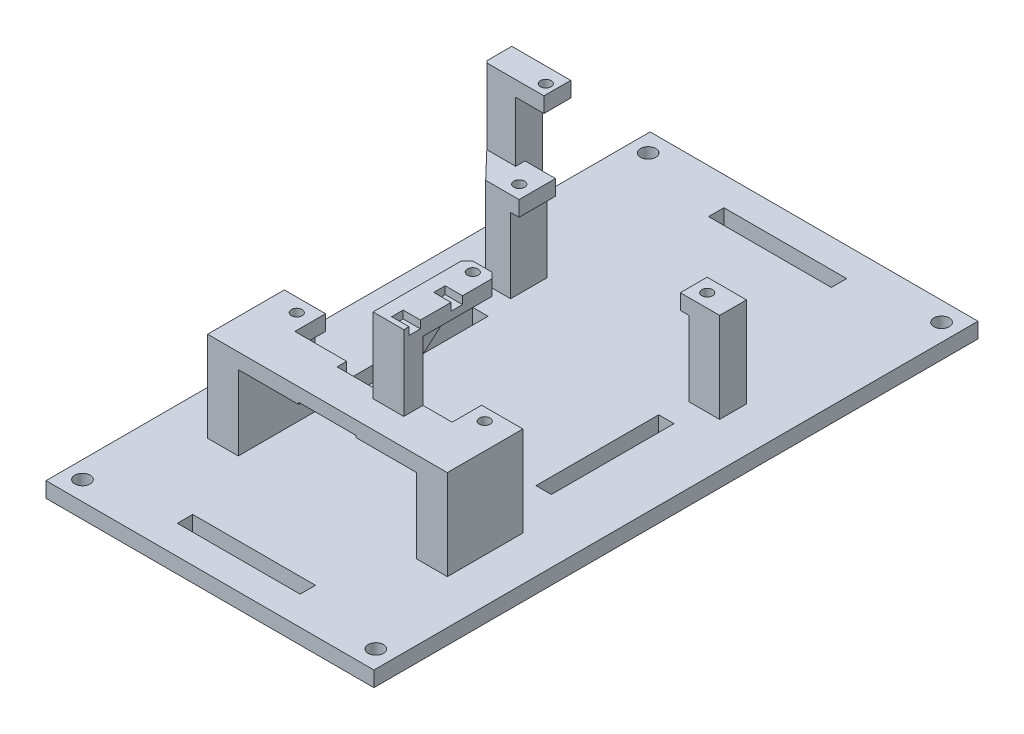
from build123d import *

# Parameters (mm, degrees)
SKETCH1_W                 = 85.5
SKETCH1_H                 = 157.5
BOSS_EXTRUDE1_DEPTH       = 4
CUT_EXTRUDE1_REACH        = 91.695
SKETCH2_R                 = 2
CUT_EXTRUDE3_REACH        = 91.695
SKETCH5_W                 = 4
SKETCH5_H                 = 32
SKETCH5_W_2               = 32
SKETCH5_H_2               = 4
SKETCH5_3_W               = 8
SKETCH5_3_H               = 7
SKETCH5_3_H_2             = 20
SKETCH5_3_H_3             = 19.7
BOSS_EXTRUDE3_DEPTH       = 23.5
SKETCH6_W                 = 20
SKETCH6_H                 = 4
BOSS_EXTRUDE5_DEPTH       = 46.5
CUT_EXTRUDE4_REACH        = 95.73
SKETCH8_W                 = 7
SKETCH8_H                 = 4
BOSS_EXTRUDE6_DEPTH       = 2.25
SKETCH9_W                 = 9.5
SKETCH9_H                 = 4
BOSS_EXTRUDE7_DEPTH       = 2.2
CUT_EXTRUDE5_START        = 23.5
SKETCH5_5_R               = 1.4
CUT_EXTRUDE5_DEPTH        = 3.5
SKETCH13_W                = 8
SKETCH13_H                = 7
SKETCH13_H_2              = 5
BOSS_EXTRUDE8_DEPTH       = 19.6
CUT_EXTRUDE11_REACH       = 95.73
SKETCH14_W                = 7
SKETCH14_H                = 4
BOSS_EXTRUDE9_DEPTH       = 7.37
SKETCH15_W                = 8
SKETCH15_H                = 4
BOSS_EXTRUDE10_DEPTH      = 19.49132
CUT_EXTRUDE6_START        = 39.1
SKETCH5_6_R               = 1.4
CUT_EXTRUDE6_DEPTH        = 4
SKETCH16_W                = 4.5
SKETCH16_H                = 3
CUT_EXTRUDE7_DEPTH        = 2
CHAMFER1_SIZE             = 1.5
BOSS_EXTRUDE11_DEPTH      = 2
BOSS_EXTRUDE11_DEPTH_BACK = 2
CUT_EXTRUDE8_REACH        = 134.032
SKETCH20_W                = 5.75
SKETCH20_H                = 6
CHAMFER2_SIZE             = 5.75
SKETCH21_W                = 2.25
SKETCH21_H                = 6
CUT_EXTRUDE9_DEPTH        = 4.56132
CHAMFER3_SIZE             = 5.75
CHAMFER3_SIZE2            = 4.56132
SKETCH22_W                = 14
SKETCH22_H                = 2.5
CUT_EXTRUDE10_DEPTH       = 2.5
CHAMFER4_SIZE             = 2.5
SKETCH24_W                = 15
SKETCH24_H                = 12
CUT_EXTRUDE12_DEPTH       = 0.5


# Some blends are built 0.0001 mm under size
with BuildPart() as part:
    # Sketch1 → Boss-Extrude1 (new body)
    with BuildSketch(Plane(origin=(0, 0, 0), x_dir=(1, 0, 0), z_dir=(0, 1, 0))):
        Rectangle(SKETCH1_W, SKETCH1_H)
    extrude(amount=BOSS_EXTRUDE1_DEPTH)

    # Sketch2 → Cut-Extrude1 (cut, up to next)
    with BuildSketch(Plane(origin=(0, 4, 0), x_dir=(1, 0, 0), z_dir=(0, 1, 0)), mode=Mode.PRIVATE) as cut_extrude1_sk1:
        with Locations(Location((38.25, -73.75, 0), (0, 0, 270))):
            Circle(SKETCH2_R)
    cut_extrude1_tool1 = extrude(cut_extrude1_sk1.sketch, amount=-CUT_EXTRUDE1_REACH, mode=Mode.PRIVATE) & part.part
    # Sketch2 → Cut-Extrude1 (cut, up to next)
    with BuildSketch(Plane(origin=(0, 4, 0), x_dir=(1, 0, 0), z_dir=(0, 1, 0)), mode=Mode.PRIVATE) as cut_extrude1_sk2:
        with Locations(Location((38.25, 73.75, 0), (0, 0, 270))):
            Circle(SKETCH2_R)
    cut_extrude1_tool2 = extrude(cut_extrude1_sk2.sketch, amount=-CUT_EXTRUDE1_REACH, mode=Mode.PRIVATE) & part.part
    # Sketch2 → Cut-Extrude1 (cut, up to next)
    with BuildSketch(Plane(origin=(0, 4, 0), x_dir=(1, 0, 0), z_dir=(0, 1, 0)), mode=Mode.PRIVATE) as cut_extrude1_sk3:
        with Locations(Location((-38.25, -73.75, 0), (0, 0, 270))):
            Circle(SKETCH2_R)
    cut_extrude1_tool3 = extrude(cut_extrude1_sk3.sketch, amount=-CUT_EXTRUDE1_REACH, mode=Mode.PRIVATE) & part.part
    # Sketch2 → Cut-Extrude1 (cut, up to next)
    with BuildSketch(Plane(origin=(0, 4, 0), x_dir=(1, 0, 0), z_dir=(0, 1, 0)), mode=Mode.PRIVATE) as cut_extrude1_sk4:
        with Locations(Location((-38.25, 73.75, 0), (0, 0, 270))):
            Circle(SKETCH2_R)
    cut_extrude1_tool4 = extrude(cut_extrude1_sk4.sketch, amount=-CUT_EXTRUDE1_REACH, mode=Mode.PRIVATE) & part.part
    add(cut_extrude1_tool1.solids().sort_by_distance((38.25, 4, 73.75))[0], mode=Mode.SUBTRACT)
    add(cut_extrude1_tool2.solids().sort_by_distance((38.25, 4, -73.75))[0], mode=Mode.SUBTRACT)
    add(cut_extrude1_tool3.solids().sort_by_distance((-38.25, 4, 73.75))[0], mode=Mode.SUBTRACT)
    add(cut_extrude1_tool4.solids().sort_by_distance((-38.25, 4, -73.75))[0], mode=Mode.SUBTRACT)

    # Sketch5 → Cut-Extrude3 (cut, up to next)
    with BuildSketch(Plane(origin=(0, 4, 0), x_dir=(1, 0, 0), z_dir=(0, 1, 0)), mode=Mode.PRIVATE) as cut_extrude3_sk1:
        with Locations((-24.25, 0)):
            Rectangle(SKETCH5_W, SKETCH5_H)
    cut_extrude3_tool1 = extrude(cut_extrude3_sk1.sketch, amount=-CUT_EXTRUDE3_REACH, mode=Mode.PRIVATE) & part.part
    # Sketch5 → Cut-Extrude3 (cut, up to next)
    with BuildSketch(Plane(origin=(0, 4, 0), x_dir=(1, 0, 0), z_dir=(0, 1, 0)), mode=Mode.PRIVATE) as cut_extrude3_sk2:
        with Locations((0, 69.25)):
            Rectangle(SKETCH5_W_2, SKETCH5_H_2)
    cut_extrude3_tool2 = extrude(cut_extrude3_sk2.sketch, amount=-CUT_EXTRUDE3_REACH, mode=Mode.PRIVATE) & part.part
    # Sketch5 → Cut-Extrude3 (cut, up to next)
    with BuildSketch(Plane(origin=(0, 4, 0), x_dir=(1, 0, 0), z_dir=(0, 1, 0)), mode=Mode.PRIVATE) as cut_extrude3_sk3:
        with Locations((0, -69.25)):
            Rectangle(SKETCH5_W_2, SKETCH5_H_2)
    cut_extrude3_tool3 = extrude(cut_extrude3_sk3.sketch, amount=-CUT_EXTRUDE3_REACH, mode=Mode.PRIVATE) & part.part
    # Sketch5 → Cut-Extrude3 (cut, up to next)
    with BuildSketch(Plane(origin=(0, 4, 0), x_dir=(1, 0, 0), z_dir=(0, 1, 0)), mode=Mode.PRIVATE) as cut_extrude3_sk4:
        with Locations((24.25, 0)):
            Rectangle(SKETCH5_W, SKETCH5_H)
    cut_extrude3_tool4 = extrude(cut_extrude3_sk4.sketch, amount=-CUT_EXTRUDE3_REACH, mode=Mode.PRIVATE) & part.part
    add(cut_extrude3_tool1.solids().sort_by_distance((-24.25, 4, 0))[0], mode=Mode.SUBTRACT)
    add(cut_extrude3_tool2.solids().sort_by_distance((0, 4, -69.25))[0], mode=Mode.SUBTRACT)
    add(cut_extrude3_tool3.solids().sort_by_distance((0, 4, 69.25))[0], mode=Mode.SUBTRACT)
    add(cut_extrude3_tool4.solids().sort_by_distance((24.25, 4, 0))[0], mode=Mode.SUBTRACT)

    # Sketch5<3> → Boss-Extrude3 (add)
    with BuildSketch(Plane(origin=(0, 4, 0), x_dir=(1, 0, 0), z_dir=(0, 1, 0))):
        Polygon((-37, 36.94993), (-29, 36.94993), (-29, 32.38861), (-23.25, 32.38861), (-23.25, 22.88861), (-29.75, 22.88861), (-37, 30.44993), align=None)
        with Locations((27.25, 26.38861)):
            Rectangle(SKETCH5_3_W, SKETCH5_3_H)
        with Locations((-27.25, -38.11139)):
            Rectangle(SKETCH5_3_W, SKETCH5_3_H_2)
        with Locations((27.25, -38.26139)):
            Rectangle(SKETCH5_3_W, SKETCH5_3_H_3)
    extrude(amount=BOSS_EXTRUDE3_DEPTH)

    # Sketch6 → Boss-Extrude5 (add)
    with BuildSketch(Plane(origin=(-23.25, 0, 0), x_dir=(0, 0, -1), z_dir=(1, 0, 0))):
        with Locations((-38.11139, 25.5)):
            Rectangle(SKETCH6_W, SKETCH6_H)
    extrude(amount=BOSS_EXTRUDE5_DEPTH)

    # Sketch7 → Cut-Extrude4 (cut, up to next)
    with BuildSketch(Plane(origin=(0, 27.5, 0), x_dir=(1, 0, 0), z_dir=(0, 1, 0)), mode=Mode.PRIVATE) as cut_extrude4_sk1:
        Polygon((-20.5, -28.11139), (23.25, -28.11139), (23.25, -28.41139), (20.5, -28.41139), (20.5, -36.11139), (-20.5, -36.11139), align=None)
    cut_extrude4_tool1 = extrude(cut_extrude4_sk1.sketch, amount=-CUT_EXTRUDE4_REACH, mode=Mode.PRIVATE) & part.part
    add(cut_extrude4_tool1.solids().sort_by_distance((0.054883, 27.5, 32.101731))[0], mode=Mode.SUBTRACT)

    # Sketch8 → Boss-Extrude6 (add)
    with BuildSketch(Plane.ZY.offset(-23.25)):
        with Locations((-26.38861, 25.5)):
            Rectangle(SKETCH8_W, SKETCH8_H)
    extrude(amount=BOSS_EXTRUDE6_DEPTH)

    # Sketch9 → Boss-Extrude7 (add)
    with BuildSketch(Plane(origin=(-23.25, 0, 0), x_dir=(0, 0, -1), z_dir=(1, 0, 0))):
        with Locations((27.63861, 25.5)):
            Rectangle(SKETCH9_W, SKETCH9_H)
    extrude(amount=BOSS_EXTRUDE7_DEPTH)

    # Sketch5<5> → Cut-Extrude5 (cut)
    with BuildSketch(Plane(origin=(0, 4, 0), x_dir=(1, 0, 0), z_dir=(0, 1, 0)).offset(CUT_EXTRUDE5_START)):
        with Locations(Location((-24.5, 26.38861, 0), (0, 0, 270))):
            Circle(SKETCH5_5_R)
        with Locations(Location((24.5, -31.61139, 0), (0, 0, 270))):
            Circle(SKETCH5_5_R)
        with Locations(Location((24.5, 26.38861, 0), (0, 0, 270))):
            Circle(SKETCH5_5_R)
        with Locations(Location((-24.5, -31.61139, 0), (0, 0, 270))):
            Circle(SKETCH5_5_R)
    extrude(amount=-CUT_EXTRUDE5_DEPTH, mode=Mode.SUBTRACT)

    # Sketch13 → Boss-Extrude8 (add)
    with BuildSketch(Plane(origin=(0, 27.5, 0), x_dir=(1, 0, 0), z_dir=(0, 1, 0))):
        with Locations((-33, 33.44993)):
            Rectangle(SKETCH13_W, SKETCH13_H)
        with Locations((8.89, -38.61139)):
            Rectangle(SKETCH13_W, SKETCH13_H_2)
    extrude(amount=BOSS_EXTRUDE8_DEPTH)

    # Sketch23 → Cut-Extrude11 (cut, up to next)
    with BuildSketch(Plane.XZ.offset(-27.5), mode=Mode.PRIVATE) as cut_extrude11_sk1:
        Polygon((-37, -29.94993), (-37, -30.44993), (-36.520586353, -29.94993), align=None)
    cut_extrude11_tool1 = extrude(cut_extrude11_sk1.sketch, amount=-CUT_EXTRUDE11_REACH, mode=Mode.PRIVATE) & part.part
    add(cut_extrude11_tool1.solids().sort_by_distance((-36.840195, 27.5, -30.116597))[0], mode=Mode.SUBTRACT)

    # Sketch14 → Boss-Extrude9 (add)
    with BuildSketch(Plane(origin=(-29, 0, 0), x_dir=(0, 0, -1), z_dir=(1, 0, 0))):
        with Locations((33.44993, 45.1)):
            Rectangle(SKETCH14_W, SKETCH14_H)
    extrude(amount=BOSS_EXTRUDE9_DEPTH)

    # Sketch15 → Boss-Extrude10 (add)
    with BuildSketch(Plane(origin=(0, 0, 36.11139), x_dir=(-1, 0, 0), z_dir=(0, 0, -1))):
        with Locations((-8.89, 45.1)):
            Rectangle(SKETCH15_W, SKETCH15_H)
    extrude(amount=BOSS_EXTRUDE10_DEPTH)

    # Sketch5<6> → Cut-Extrude6 (cut)
    with BuildSketch(Plane(origin=(0, 4, 0), x_dir=(1, 0, 0), z_dir=(0, 1, 0)).offset(CUT_EXTRUDE6_START)):
        with Locations(Location((-24.13, 32.94993, 0), (0, 0, 270))):
            Circle(SKETCH5_6_R)
        with Locations(Location((8.89, -19.12007, 0), (0, 0, 270))):
            Circle(SKETCH5_6_R)
    extrude(amount=CUT_EXTRUDE6_DEPTH, mode=Mode.SUBTRACT)

    # Sketch16 → Cut-Extrude7 (cut)
    with BuildSketch(Plane(origin=(0, 47.1, 0), x_dir=(1, 0, 0), z_dir=(0, 1, 0))):
        with Locations((10.64, -27.29907)):
            Rectangle(SKETCH16_W, SKETCH16_H)
        with Locations((10.64, -38.27207)):
            Rectangle(SKETCH16_W, SKETCH16_H)
    extrude(amount=-CUT_EXTRUDE7_DEPTH, mode=Mode.SUBTRACT)

    # Chamfer1
    chamfer1_edges = [part.edges().sort_by_distance(p)[0] for p in [
        (12.89, 45.1, 16.62007),
        (4.89, 45.1, 16.62007),
    ]]
    chamfer(chamfer1_edges, length=CHAMFER1_SIZE)

    # Sketch19 → Boss-Extrude11 (add, two sides: drawn at the far end of the back side and taken through both)
    with BuildSketch(Plane.ZY.offset(-8.89).offset(-BOSS_EXTRUDE11_DEPTH_BACK)):
        Polygon((27.11573, 43.1), (36.11139, 35.3), (36.11139, 43.1), align=None)
    extrude(amount=BOSS_EXTRUDE11_DEPTH + BOSS_EXTRUDE11_DEPTH_BACK)

    # Cut-Extrude8: up to this plane
    cut_extrude8_end = Plane(origin=(-4.065843585, 27.5, 3.898441805), z_dir=(0.7218100693808475, 0, -0.6920911961153792))
    # Sketch20 → Cut-Extrude8 (cut, up to the surface)
    with BuildSketch(Plane(origin=(0, 0, -36.94993), x_dir=(-1, 0, 0), z_dir=(0, 0, -1)), mode=Mode.PRIVATE) as cut_extrude8_sk1:
        with Locations((34.125, 7)):
            Rectangle(SKETCH20_W, SKETCH20_H)
    cut_extrude8_tool1 = split(extrude(cut_extrude8_sk1.sketch, amount=-CUT_EXTRUDE8_REACH, mode=Mode.PRIVATE), bisect_by=cut_extrude8_end, keep=Keep.BOTH, mode=Mode.PRIVATE)
    add(cut_extrude8_tool1.solids().sort_by_distance((-34.125, 7, -36.94993))[0], mode=Mode.SUBTRACT)

    # Chamfer2
    chamfer2_edges = [part.edges().sort_by_distance(p)[0] for p in [
        (-37, 10, -33.69993),
    ]]
    chamfer(chamfer2_edges, length=CHAMFER2_SIZE - 0.0001)  # a hair under: the kernel refuses the full size

    # Sketch21 → Cut-Extrude9 (cut)
    with BuildSketch(Plane(origin=(0, 0, -36.94993), x_dir=(-1, 0, 0), z_dir=(0, 0, -1))):
        with Locations((30.125, 7)):
            Rectangle(SKETCH21_W, SKETCH21_H)
    extrude(amount=-CUT_EXTRUDE9_DEPTH, mode=Mode.SUBTRACT)

    # Chamfer3
    chamfer3_edges = [part.edges().sort_by_distance(p)[0] for p in [
        (-30.125, 10, -36.94993),
    ]]
    chamfer3_side = [part.faces().sort_by_distance(p)[0] for p in [
        (-32.15740492, 31.012813369, -36.94993),
    ]]
    chamfer(chamfer3_edges, length=CHAMFER3_SIZE, length2=CHAMFER3_SIZE2, reference=chamfer3_side[0])

    # Sketch22 → Cut-Extrude10 (cut)
    with BuildSketch(Plane(origin=(0, 27.5, 0), x_dir=(1, 0, 0), z_dir=(0, 1, 0))):
        with Locations((0, -37.36139)):
            Rectangle(SKETCH22_W, SKETCH22_H)
    extrude(amount=-CUT_EXTRUDE10_DEPTH, mode=Mode.SUBTRACT)

    # Chamfer4
    # the kernel refuses this chamfer: 2.5 mm, written as the material it takes off along each edge
    with BuildSketch(Plane(origin=(4.89, 27.5, 45.04059747), x_dir=(0, 1, 0), z_dir=(0, 0, -1))) as chamfer4_piece_1_section:
        Polygon((CHAMFER4_SIZE, 0), (0, CHAMFER4_SIZE), (0, 0), align=None)
    chamfer4_piece_1 = extrude(amount=15.35841494, mode=Mode.PRIVATE)
    chamfer4_piece_1 = split(chamfer4_piece_1, bisect_by=Plane(origin=(7, 27.5, 45.04059747), z_dir=(-1, 0, 0)), keep=Keep.TOP, mode=Mode.PRIVATE)
    chamfer4_piece_1 = split(chamfer4_piece_1, bisect_by=Plane(origin=(4.89, 24.285396265, 41.825993735), z_dir=(0, -0.7071067811865476, -0.7071067811865476)), keep=Keep.TOP, mode=Mode.PRIVATE)
    add(chamfer4_piece_1, mode=Mode.SUBTRACT)
    with BuildSketch(Plane(origin=(7, 27.5, 36.11139), x_dir=(0, 1, 0), z_dir=(-1, 0, 0))) as chamfer4_piece_2:
        Polygon((CHAMFER4_SIZE, 0), (0, -CHAMFER4_SIZE), (0, 0), align=None)
    extrude(amount=8.53920747, mode=Mode.SUBTRACT)

    # Sketch24 → Cut-Extrude12 (cut)
    with BuildSketch(Plane.XZ.offset(-23.5)):
        with Locations((0, 42.11139)):
            Rectangle(SKETCH24_W, SKETCH24_H)
    extrude(amount=-CUT_EXTRUDE12_DEPTH, mode=Mode.SUBTRACT)


solid = part.part
